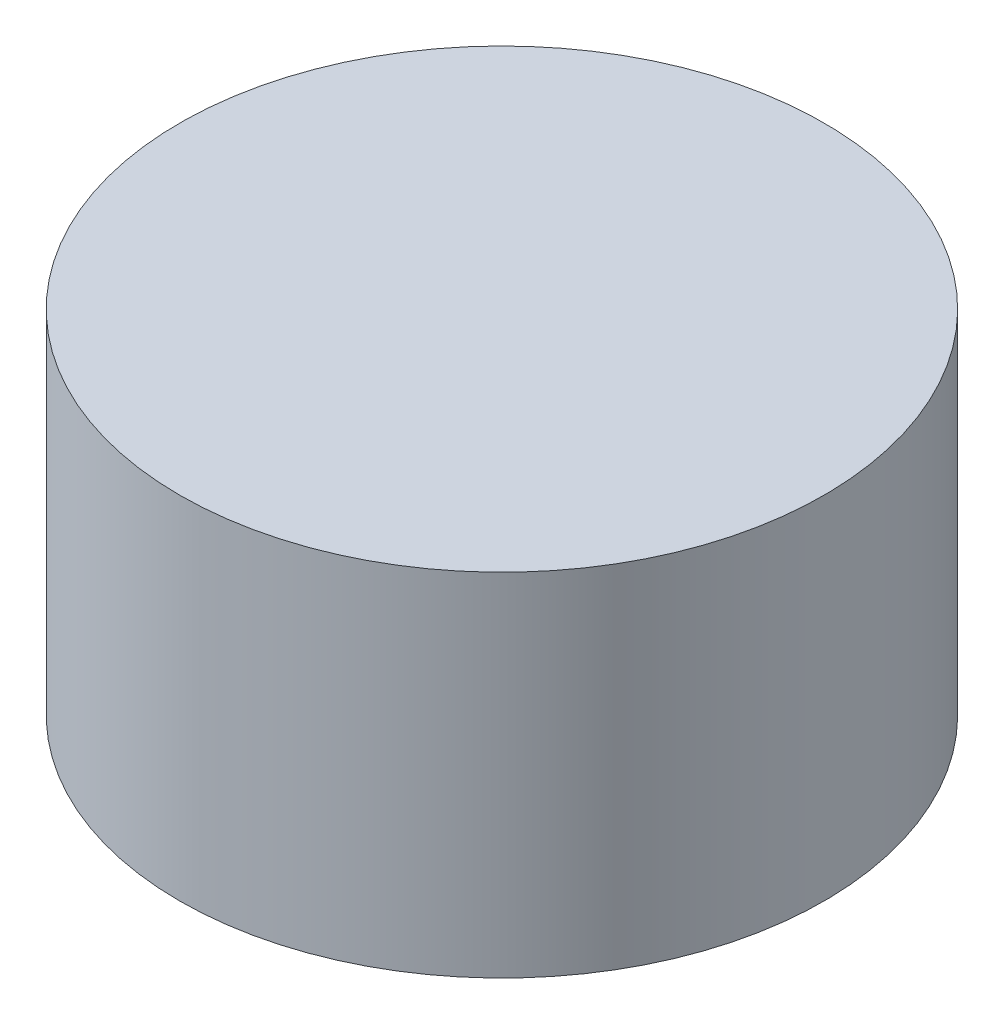
from build123d import *

# Parameters (mm, degrees)
SKETCH1_R           = 73.35
BOSS_EXTRUDE1_DEPTH = 40


with BuildPart() as part:
    # Sketch1 → Boss-Extrude1 (new, symmetric)
    with BuildSketch(Plane(origin=(0, 0, 0), x_dir=(1, 0, 0), z_dir=(0, 1, 0))):
        Circle(SKETCH1_R)
    extrude(amount=BOSS_EXTRUDE1_DEPTH, both=True)


solid = part.part
